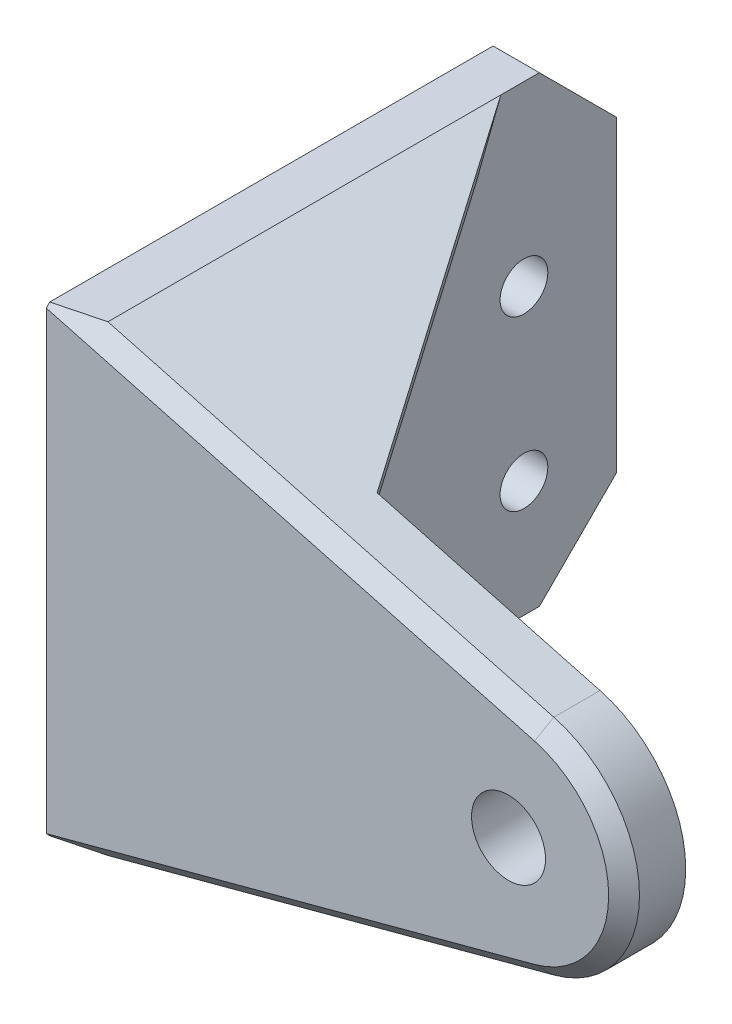
from build123d import *

# Parameters (mm, degrees)
BOSS_EXTRUDE1_DEPTH = 4
SKETCH3_W           = 3
SKETCH3_H           = 30
BOSS_EXTRUDE2_DEPTH = 30
BOSS_EXTRUDE3_DEPTH = 4
CHAMFER1_SIZE       = 5
CHAMFER2_SIZE       = 5
CHAMFER3_SIZE       = 1
CUT_EXTRUDE3_REACH  = 52.128
SKETCH6_R           = 1.55
CUT_EXTRUDE4_REACH  = 45.819
SKETCH7_R           = 2.4


with BuildPart() as part:
    # Sketch1 → Boss-Extrude1 (new body)
    with BuildSketch(Plane.XY):
        with BuildLine():
            Line((-21.444, -9.44375), (7.49732978, -1.688143604))
            ThreePointArc((7.49732978, -1.688143604), (13.056, 5.55625), (7.49732978, 12.800643604))
            Line((7.49732978, 12.800643604), (-21.444, 20.55625))
            Line((-21.444, 20.55625), (-24.444, 20.55625))
            Line((-24.444, 20.55625), (-24.444, -9.44375))
            Line((-24.444, -9.44375), (-21.444, -9.44375))
        make_face()
    extrude(amount=BOSS_EXTRUDE1_DEPTH)

    # Sketch3 → Boss-Extrude2 (add)
    with BuildSketch(Plane(origin=(0, 0, 0), x_dir=(-1, 0, 0), z_dir=(0, 0, -1))):
        with Locations((22.944, 5.55625)):
            Rectangle(SKETCH3_W, SKETCH3_H)
    extrude(amount=BOSS_EXTRUDE2_DEPTH)

    # Sketch4 → Boss-Extrude3 (add)
    with BuildSketch(Plane(origin=(3.702769565, 13.817497898, 0), x_dir=(0.9659191471648285, -0.25884397064712666, 0), z_dir=(0.25884397064712666, 0.9659191471648285, 0))):
        Polygon((-26.034031563, 22.5), (-11.052793297, 0), (-11.052793297, -0.5), (-26.034031563, -0.5), align=None)
    extrude(amount=-BOSS_EXTRUDE3_DEPTH)

    # Chamfer1
    chamfer1_edges = [part.edges().sort_by_distance(p)[0] for p in [
        (-21.444, 3.485683322, 0),
    ]]
    chamfer(chamfer1_edges, length=CHAMFER1_SIZE)

    # Chamfer2
    chamfer2_edges = [part.edges().sort_by_distance(p)[0] for p in [
        (-22.944, -9.44375, -30),
        (-22.944, 20.55625, -30),
    ]]
    chamfer(chamfer2_edges, length=CHAMFER2_SIZE)

    # Chamfer3
    chamfer3_edges = [part.edges().sort_by_distance(p)[0] for p in [
        (-6.97333511, -5.565946802, 4),
        (13.056, 5.55625, 4),
        (-6.97333511, 16.678446802, 4),
    ]]
    chamfer(chamfer3_edges, length=CHAMFER3_SIZE)

    # Sketch6 → Cut-Extrude3 (cut, up to next)
    with BuildSketch(Plane(origin=(-21.444, 0, 0), x_dir=(0, 0, -1), z_dir=(1, 0, 0)), mode=Mode.PRIVATE) as cut_extrude3_sk1:
        with Locations((11, 9.04722098)):
            Circle(SKETCH6_R)
    cut_extrude3_tool1 = extrude(cut_extrude3_sk1.sketch, amount=-CUT_EXTRUDE3_REACH, mode=Mode.PRIVATE) & part.part
    # Sketch6 → Cut-Extrude3 (cut, up to next)
    with BuildSketch(Plane(origin=(-21.444, 0, 0), x_dir=(0, 0, -1), z_dir=(1, 0, 0)), mode=Mode.PRIVATE) as cut_extrude3_sk2:
        with Locations((24, 9.04722098)):
            Circle(SKETCH6_R)
    cut_extrude3_tool2 = extrude(cut_extrude3_sk2.sketch, amount=-CUT_EXTRUDE3_REACH, mode=Mode.PRIVATE) & part.part
    # Sketch6 → Cut-Extrude3 (cut, up to next)
    with BuildSketch(Plane(origin=(-21.444, 0, 0), x_dir=(0, 0, -1), z_dir=(1, 0, 0)), mode=Mode.PRIVATE) as cut_extrude3_sk3:
        with Locations((11, -1.889802378)):
            Circle(SKETCH6_R)
    cut_extrude3_tool3 = extrude(cut_extrude3_sk3.sketch, amount=-CUT_EXTRUDE3_REACH, mode=Mode.PRIVATE) & part.part
    # Sketch6 → Cut-Extrude3 (cut, up to next)
    with BuildSketch(Plane(origin=(-21.444, 0, 0), x_dir=(0, 0, -1), z_dir=(1, 0, 0)), mode=Mode.PRIVATE) as cut_extrude3_sk4:
        with Locations((24, -1.889802378)):
            Circle(SKETCH6_R)
    cut_extrude3_tool4 = extrude(cut_extrude3_sk4.sketch, amount=-CUT_EXTRUDE3_REACH, mode=Mode.PRIVATE) & part.part
    add(cut_extrude3_tool1.solids().sort_by_distance((-21.444, 9.047221, -11))[0], mode=Mode.SUBTRACT)
    add(cut_extrude3_tool2.solids().sort_by_distance((-21.444, 9.047221, -24))[0], mode=Mode.SUBTRACT)
    add(cut_extrude3_tool3.solids().sort_by_distance((-21.444, -1.889802, -11))[0], mode=Mode.SUBTRACT)
    add(cut_extrude3_tool4.solids().sort_by_distance((-21.444, -1.889802, -24))[0], mode=Mode.SUBTRACT)

    # Sketch7 → Cut-Extrude4 (cut, up to next)
    with BuildSketch(Plane(origin=(0, 0, 0), x_dir=(-1, 0, 0), z_dir=(0, 0, -1)), mode=Mode.PRIVATE) as cut_extrude4_sk1:
        with Locations((-5.556, 5.55625)):
            Circle(SKETCH7_R)
    cut_extrude4_tool1 = extrude(cut_extrude4_sk1.sketch, amount=-CUT_EXTRUDE4_REACH, mode=Mode.PRIVATE) & part.part
    add(cut_extrude4_tool1.solids().sort_by_distance((5.556, 5.55625, 0))[0], mode=Mode.SUBTRACT)


solid = part.part
